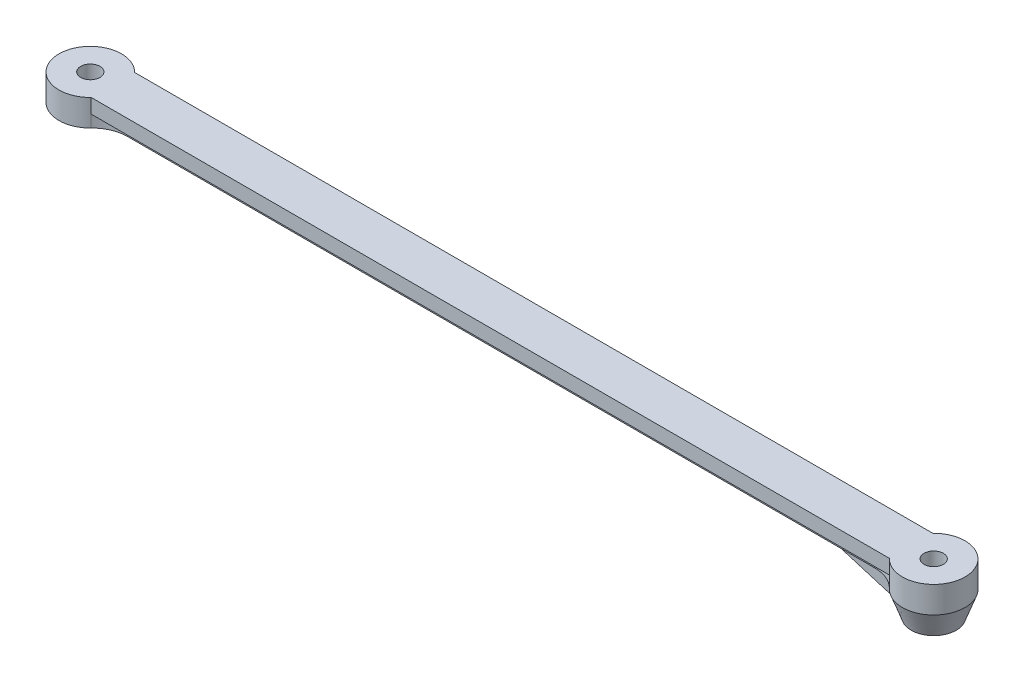
from build123d import *

# Parameters (mm, degrees)
SKETCH1_R           = 2
BOSS_EXTRUDE1_DEPTH = 5.5
CUT_EXTRUDE1_DEPTH  = 2.5
SKETCH4_R           = 6.5
SKETCH3_R           = 4.68
SKETCH5_R           = 2
CUT_EXTRUDE2_DEPTH  = 182.919625113
BOSS_EXTRUDE2_DEPTH = 1.25


with BuildPart() as part:
    # Sketch1 → Boss-Extrude1 (new body)
    with BuildSketch(Plane(origin=(0, 0, 0), x_dir=(1, 0, 0), z_dir=(0, 1, 0))):
        with BuildLine():
            Line((-170.30958424, 4.5), (-4.69041576, 4.5))
            ThreePointArc((-4.69041576, 4.5), (6.5, 0), (-4.69041576, -4.5))
            Line((-4.69041576, -4.5), (-170.30958424, -4.5))
            ThreePointArc((-170.30958424, -4.5), (-181.5, 0), (-170.30958424, 4.5))
        make_face()
        Circle(SKETCH1_R, mode=Mode.SUBTRACT)
        with Locations((-175, 0)):
            Circle(SKETCH1_R, mode=Mode.SUBTRACT)
    extrude(amount=BOSS_EXTRUDE1_DEPTH)

    # Sketch2 → Cut-Extrude1 (cut)
    with BuildSketch(Plane.XZ):
        with BuildLine():
            Line((-9.96713349, 2.25), (-165.03286651, 2.25))
            ThreePointArc((-165.03286651, 2.25), (-167.901064987, 2.835978332), (-170.30958424, 4.5))
            Line((-170.30958424, 4.5), (-4.69041576, 4.5))
            ThreePointArc((-4.69041576, 4.5), (-7.098935013, 2.835978332), (-9.96713349, 2.25))
        make_face()
        with BuildLine():
            Line((-9.96713349, -2.25), (-165.03286651, -2.25))
            ThreePointArc((-165.03286651, -2.25), (-167.901064987, -2.835978332), (-170.30958424, -4.5))
            Line((-170.30958424, -4.5), (-4.69041576, -4.5))
            ThreePointArc((-4.69041576, -4.5), (-7.098935013, -2.835978332), (-9.96713349, -2.25))
        make_face()
    extrude(amount=-CUT_EXTRUDE1_DEPTH, mode=Mode.SUBTRACT)

    # Sketch4 → Loft1 section 0
    with BuildSketch(Plane.XZ):
        Circle(SKETCH4_R)
    # Sketch3 → Loft1 section 1
    with BuildSketch(Plane(origin=(0, -5, 0), x_dir=(-1, 0, 0), z_dir=(0, -1, 0))):
        Circle(SKETCH3_R)
    loft()

    # Sketch5 → Cut-Extrude2 (cut, through all)
    with BuildSketch(Plane.XZ.offset(5)):
        Circle(SKETCH5_R)
    extrude(amount=-CUT_EXTRUDE2_DEPTH, mode=Mode.SUBTRACT)

    # Sketch6 → Boss-Extrude2 (add, symmetric)
    with BuildSketch(Plane.XY):
        Polygon((-3.080000032, 0), (-21.280000032, 0), (-4.680000032, -5), (-3.080000032, -5), align=None)
    extrude(amount=BOSS_EXTRUDE2_DEPTH, both=True)


solid = part.part
